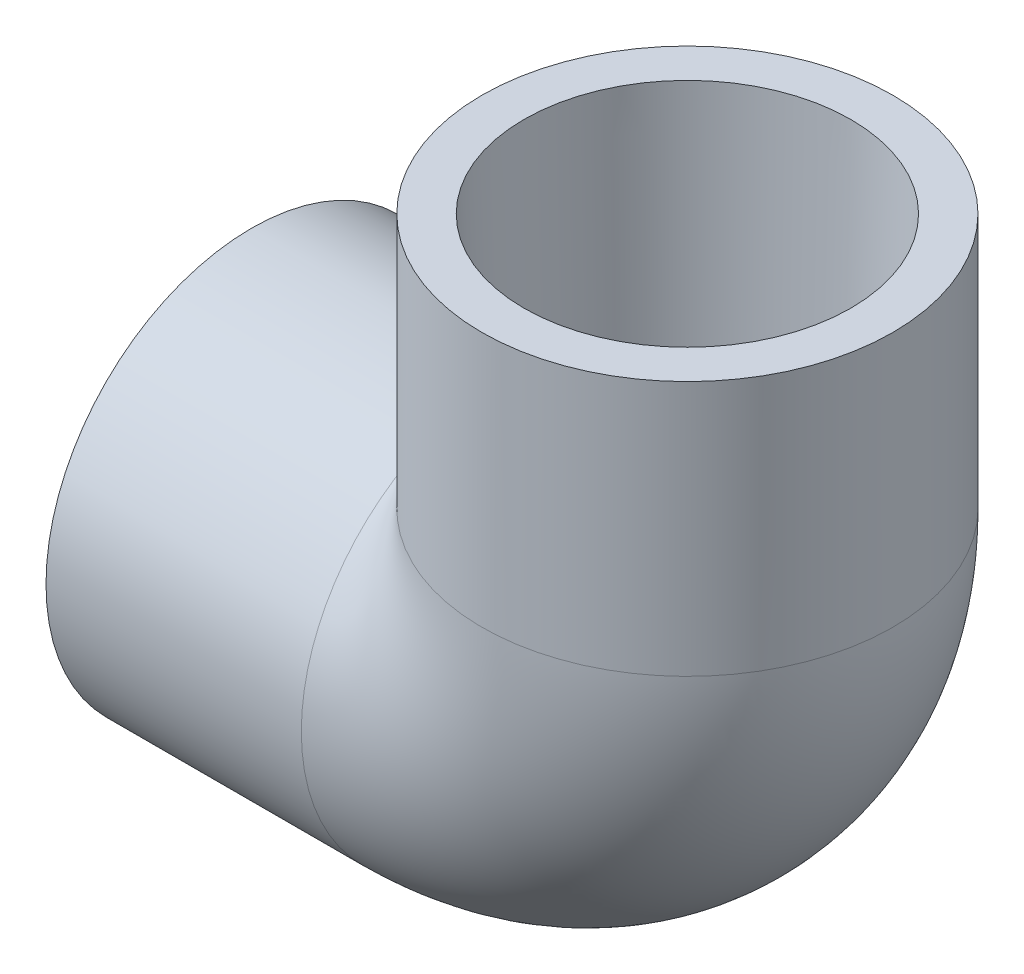
from build123d import *

# Parameters (mm, degrees)
SKETCH3_R   = 16.764
SKETCH3_R_2 = 12.6873


with BuildPart() as part:
    # Sketch1 → Revolve1 (revolve)
    with BuildSketch(Plane.XY):
        Polygon((-14.732, -12.6873), (-14.732, -16.764), (-35.56, -16.764), (-35.56, -13.335), align=None)
    revolve(axis=Axis((-35.56, 0, 0), (1, 0, 0)))


with BuildPart() as body_2:
    # Sketch2 → Revolve2 (revolve)
    with BuildSketch(Plane.XY):
        Polygon((13.335, 35.56), (12.686518, 14.732), (16.764, 14.732), (16.764, 35.56), align=None)
    revolve(axis=Axis((0, 0, 0), (0, 1, 0)))


with BuildPart() as sweep1_tool:
    # Sweep1: sweep along a path in Sketch4
    with BuildLine(Plane.XY) as sweep1_path:
        ThreePointArc((-14.732, 0), (-4.314903, 4.314903), (0, 14.732))
    # Sketch3 → Sweep1 (sweep)
    with BuildSketch(Plane(origin=(-14.732, 0, 0), x_dir=(0, 0, -1), z_dir=(1, 0, 0))):
        Circle(SKETCH3_R)
        Circle(SKETCH3_R_2, mode=Mode.SUBTRACT)
    sweep(path=sweep1_path.line)


with BuildPart() as part_1:
    add(part.part)


with BuildPart() as part_2:
    # Sweep1: joined with sweep1_tool
    add(part_1.part.fuse(sweep1_tool.part, body_2.part, tol=0.00001))


solid = part_2.part
